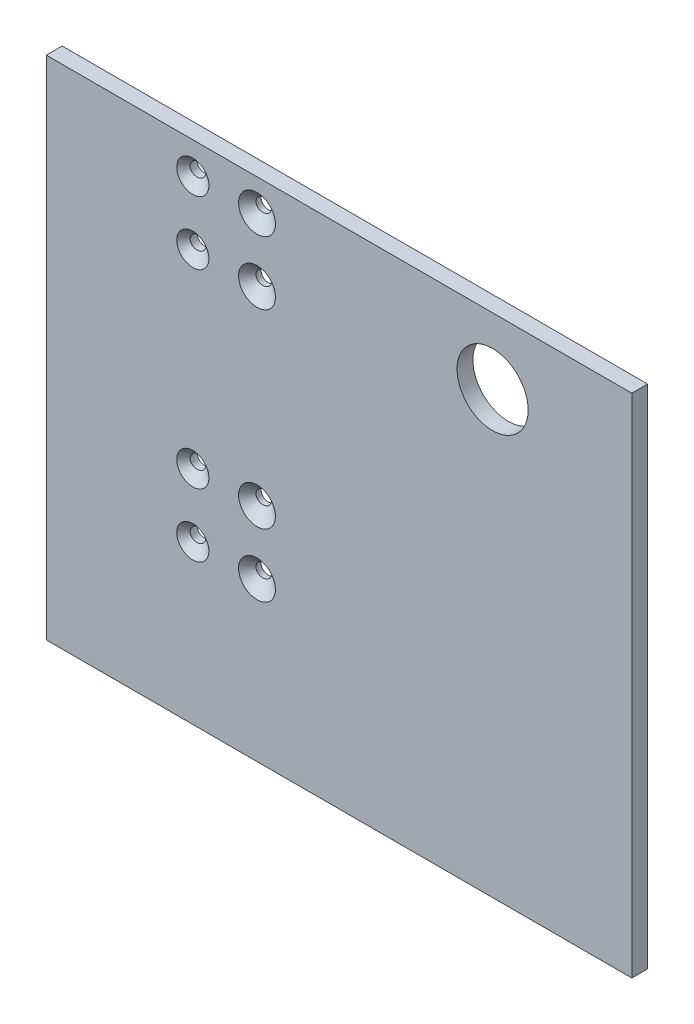
from build123d import *

# Parameters (mm, degrees)
SKETCH1_W                                          = 234.95
SKETCH1_H                                          = 203.2
BOSS_EXTRUDE1_DEPTH                                = 6.35
SKETCH2_R                                          = 14.2748
CUT_EXTRUDE1_DEPTH                                 = 156.445354144
CSK_FOR_10_FLAT_HEAD_MACHINE_SCREW_100_D           = 5.6134
CSK_FOR_10_FLAT_HEAD_MACHINE_SCREW_100_CSINK_D     = 17.78
CSK_FOR_10_FLAT_HEAD_MACHINE_SCREW_100_CSINK_ANGLE = 90
CSK_FOR_10_FLAT_HEAD_MACHINE_SCREW_2_D             = 5.6134
CSK_FOR_10_FLAT_HEAD_MACHINE_SCREW_2_CSINK_D       = 17.78
CSK_FOR_10_FLAT_HEAD_MACHINE_SCREW_2_CSINK_ANGLE   = 90


with BuildPart() as part:
    # Sketch1 → Boss-Extrude1 (new body)
    with BuildSketch(Plane.XY):
        Rectangle(SKETCH1_W, SKETCH1_H)
    extrude(amount=BOSS_EXTRUDE1_DEPTH)

    # Sketch2 → Cut-Extrude1 (cut, through all)
    with BuildSketch(Plane.XY.offset(6.35)):
        with Locations((61.595, 74.93)):
            Circle(SKETCH2_R)
    extrude(amount=-CUT_EXTRUDE1_DEPTH, mode=Mode.SUBTRACT)

    # CSK for _10 Flat Head Machine Screw _100 (through all)
    with Locations(Plane(origin=(271.17770657, -265.595089466, -36.034392524), x_dir=(-0.9908610866457157, 0, 0.1348862742137668), z_dir=(0.1348862742137668, 2.0193719939519572e-15, 0.9908610866457157))):
        with Locations((333.441972913, -227.495089466), (333.441972913, -252.895089466), (333.441972913, -329.095089466), (333.441972913, -354.495089466)):
            CounterSinkHole(CSK_FOR_10_FLAT_HEAD_MACHINE_SCREW_100_D / 2, CSK_FOR_10_FLAT_HEAD_MACHINE_SCREW_100_CSINK_D / 2, counter_sink_angle=CSK_FOR_10_FLAT_HEAD_MACHINE_SCREW_100_CSINK_ANGLE)

    # CSK for _10 Flat Head Machine Screw  2 (through all)
    with Locations(Plane(origin=(271.520317707, -265.595089466, -33.517605364), x_dir=(-0.9908610866457157, 0, 0.1348862742137668), z_dir=(0.1348862742137668, 2.0193719939519572e-15, 0.9908610866457157))):
        with Locations((308.041972913, -252.895089466), (308.041972913, -227.495089466), (308.041972913, -329.095089466), (308.041972913, -354.495089466)):
            CounterSinkHole(CSK_FOR_10_FLAT_HEAD_MACHINE_SCREW_2_D / 2, CSK_FOR_10_FLAT_HEAD_MACHINE_SCREW_2_CSINK_D / 2, counter_sink_angle=CSK_FOR_10_FLAT_HEAD_MACHINE_SCREW_2_CSINK_ANGLE)


solid = part.part
